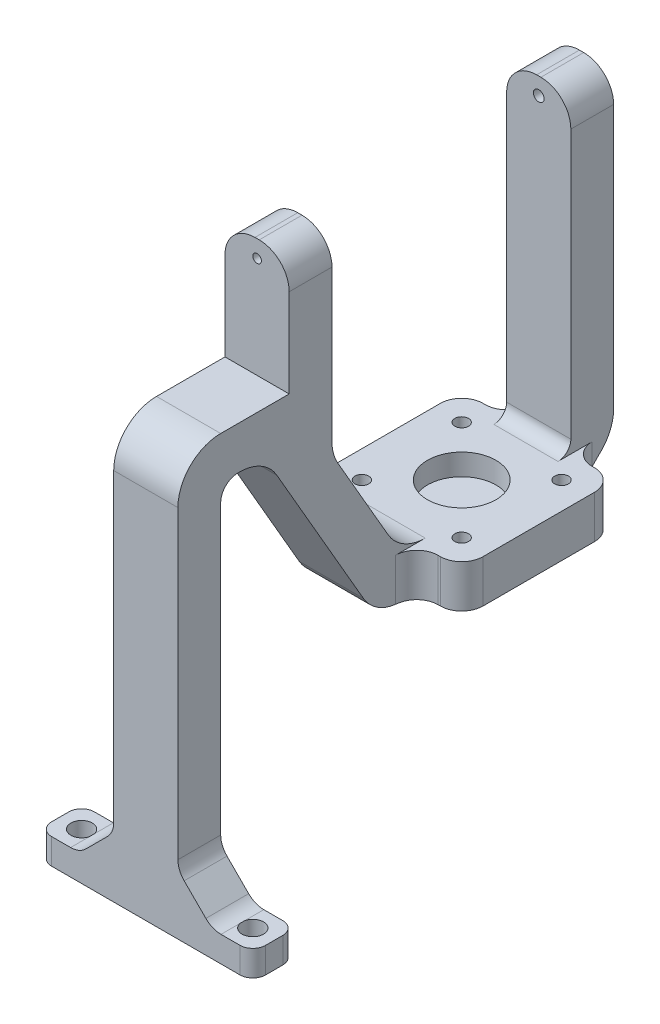
from build123d import *

# Parameters (mm, degrees)
SKETCH1_W           = 40
SKETCH1_H           = 50
BOSS_EXTRUDE1_DEPTH = 5
BOSS_EXTRUDE2_DEPTH = 7.5
FILLET3_R           = 10
SKETCH6_W           = 36
SKETCH6_H           = 10
BOSS_EXTRUDE3_DEPTH = 18
SKETCH7_R           = 8
CUT_EXTRUDE3_DEPTH  = 5
FILLET5_R           = 5
SKETCH8_R           = 1.6
CUT_EXTRUDE4_DEPTH  = 100.116132934
FILLET6_R           = 3
BOSS_EXTRUDE4_DEPTH = 15
SKETCH10_R          = 1
CUT_EXTRUDE5_DEPTH  = 500.756658462
FILLET8_R           = 10
FILLET9_R           = 7
CUT_EXTRUDE7_DEPTH  = 5
FILLET10_R          = 4
SKETCH13_W          = 10
SKETCH13_H          = 6
BOSS_EXTRUDE5_DEPTH = 25
CHAMFER1_SIZE       = 8
FILLET11_R          = 5
FILLET12_R          = 3
BOSS_EXTRUDE7_DEPTH = 10
CHAMFER2_SIZE       = 10
FILLET15_R          = 10
FILLET16_R          = 3
FILLET17_R          = 5
SKETCH19_R          = 1.25
CUT_EXTRUDE8_DEPTH  = 10
SKETCH20_R          = 2.5
CUT_EXTRUDE9_DEPTH  = 153.367653519


with BuildPart() as part:
    # Sketch1 → Boss-Extrude1 (new body)
    with BuildSketch(Plane.XY):
        with Locations((0, 421.657979857)):
            Rectangle(SKETCH1_W, SKETCH1_H)
    extrude(amount=BOSS_EXTRUDE1_DEPTH)

    # Sketch5 → Boss-Extrude2 (add, symmetric)
    with BuildSketch(Plane(origin=(0, 0, 0), x_dir=(0, 0, -1), z_dir=(1, 0, 0))):
        Polygon((-10, 370), (-10, 467.320715151), (16, 467.320715151), (42.019504932, 422.253610621), (76.24600224, 422.253610621), (76.24600224, 412.253610621), (36.24600224, 412.253610621), (10.226497308, 457.320715151), (0, 457.320715151), (0, 370), align=None)
    extrude(amount=BOSS_EXTRUDE2_DEPTH, both=True)

    # Fillet3
    fillet3_edges = [part.edges().sort_by_distance(p)[0] for p in [
        (0, 457.320715151, -10.226497308),
        (0, 412.253610621, -36.24600224),
        (0, 422.253610621, -42.019504932),
        (0, 467.320715151, 10),
    ]]
    fillet(fillet3_edges, radius=FILLET3_R)

    # Sketch6 → Boss-Extrude3 (add, symmetric)
    with BuildSketch(Plane(origin=(0, 0, 0), x_dir=(0, 0, -1), z_dir=(1, 0, 0))):
        with Locations((63.814228499, 417.253610621)):
            Rectangle(SKETCH6_W, SKETCH6_H)
    extrude(amount=BOSS_EXTRUDE3_DEPTH, both=True)

    # Sketch7 → Cut-Extrude3 (cut)
    with BuildSketch(Plane(origin=(0, 422.253610621, 0), x_dir=(1, 0, 0), z_dir=(0, 1, 0))):
        with Locations(Location((0, 63.814228499, 0), (0, 0, 270))):
            Circle(SKETCH7_R)
    extrude(amount=-CUT_EXTRUDE3_DEPTH, mode=Mode.SUBTRACT)

    # Fillet5
    fillet5_edges = [part.edges().sort_by_distance(p)[0] for p in [
        (-7.5, 417.253610621, -45.814228499),
    ]]
    fillet(fillet5_edges, radius=FILLET5_R)
    fillet5_2_edges = [part.edges().sort_by_distance(p)[0] for p in [
        (-18, 417.253610621, -45.814228499),
    ]]
    fillet(fillet5_2_edges, radius=FILLET5_R)
    fillet5_3_edges = [part.edges().sort_by_distance(p)[0] for p in [
        (7.5, 417.253610621, -45.814228499),
    ]]
    fillet(fillet5_3_edges, radius=FILLET5_R)
    fillet5_4_edges = [part.edges().sort_by_distance(p)[0] for p in [
        (18, 417.253610621, -45.814228499),
    ]]
    fillet(fillet5_4_edges, radius=FILLET5_R)
    fillet5_5_edges = [part.edges().sort_by_distance(p)[0] for p in [
        (18, 417.253610621, -81.814228499),
    ]]
    fillet(fillet5_5_edges, radius=FILLET5_R)
    fillet5_6_edges = [part.edges().sort_by_distance(p)[0] for p in [
        (-18, 417.253610621, -81.814228499),
    ]]
    fillet(fillet5_6_edges, radius=FILLET5_R)

    # Sketch8 → Cut-Extrude4 (cut, through all)
    with BuildSketch(Plane(origin=(0, 422.253610621, 0), x_dir=(1, 0, 0), z_dir=(0, 1, 0))):
        with Locations(Location((11.66726189, 52.14696661, 0), (0, 0, 270))):
            Circle(SKETCH8_R)
        with Locations(Location((-11.66726189, 52.14696661, 0), (0, 0, 270))):
            Circle(SKETCH8_R)
        with Locations(Location((-11.66726189, 75.481490389, 0), (0, 0, 270))):
            Circle(SKETCH8_R)
        with Locations(Location((11.66726189, 75.481490389, 0), (0, 0, 270))):
            Circle(SKETCH8_R)
    extrude(amount=-CUT_EXTRUDE4_DEPTH, mode=Mode.SUBTRACT)

    # Fillet6
    fillet6_edges = [part.edges().sort_by_distance(p)[0] for p in [
        (-20, 446.657979857, 2.5),
        (20, 446.657979857, 2.5),
        (20, 396.657979857, 2.5),
        (-20, 396.657979857, 2.5),
    ]]
    fillet(fillet6_edges, radius=FILLET6_R)

    # Sketch9 → Boss-Extrude4 (add)
    with BuildSketch(Plane(origin=(7.5, 0, 0), x_dir=(0, 0, -1), z_dir=(1, 0, 0))):
        Polygon((26, 450.000207075), (26, 495.000207075), (16, 495.000207075), (16, 467.320715151), align=None)
    extrude(amount=-BOSS_EXTRUDE4_DEPTH)

    # Sketch10 → Cut-Extrude5 (cut, through all)
    with BuildSketch(Plane.XY.offset(-16)):
        with Locations((0, 491.000207075)):
            Circle(SKETCH10_R)
    extrude(amount=-CUT_EXTRUDE5_DEPTH, mode=Mode.SUBTRACT)

    # Fillet8
    fillet8_edges = [part.edges().sort_by_distance(p)[0] for p in [
        (0, 450.000207075, -26),
    ]]
    fillet(fillet8_edges, radius=FILLET8_R)

    # Fillet9
    fillet9_edges = [part.edges().sort_by_distance(p)[0] for p in [
        (7.5, 495.000207075, -21),
        (-7.5, 495.000207075, -21),
    ]]
    fillet(fillet9_edges, radius=FILLET9_R)

    # Sketch12 → Cut-Extrude7 (cut)
    with BuildSketch(Plane.XY.offset(5)):
        with BuildLine():
            Line((7.5, 396.657979857), (17, 396.657979857))
            ThreePointArc((17, 396.657979857), (19.121320344, 397.536659513), (20, 399.657979857))
            Line((20, 399.657979857), (20, 443.657979857))
            ThreePointArc((20, 443.657979857), (19.121320344, 445.7793002), (17, 446.657979857))
            Line((17, 446.657979857), (7.5, 446.657979857))
            Line((7.5, 446.657979857), (7.5, 396.657979857))
        make_face()
        with BuildLine():
            Line((-20, 443.657979857), (-20, 399.657979857))
            ThreePointArc((-20, 399.657979857), (-19.121320344, 397.536659513), (-17, 396.657979857))
            Line((-17, 396.657979857), (-7.5, 396.657979857))
            Line((-7.5, 396.657979857), (-7.5, 446.657979857))
            Line((-7.5, 446.657979857), (-17, 446.657979857))
            ThreePointArc((-17, 446.657979857), (-19.121320344, 445.7793002), (-20, 443.657979857))
        make_face()
    extrude(amount=-CUT_EXTRUDE7_DEPTH, mode=Mode.SUBTRACT)

    # Fillet10
    fillet10_edges = [part.edges().sort_by_distance(p)[0] for p in [
        (0, 457.320715151, 0),
    ]]
    fillet(fillet10_edges, radius=FILLET10_R)

    # Sketch13 → Boss-Extrude5 (add, symmetric)
    with BuildSketch(Plane(origin=(0, 0, 0), x_dir=(0, 0, -1), z_dir=(1, 0, 0))):
        with Locations((-5, 373)):
            Rectangle(SKETCH13_W, SKETCH13_H)
    extrude(amount=BOSS_EXTRUDE5_DEPTH, both=True)

    # Chamfer1
    chamfer1_edges = [part.edges().sort_by_distance(p)[0] for p in [
        (7.5, 376, 5),
        (-7.5, 376, 5),
    ]]
    chamfer(chamfer1_edges, length=CHAMFER1_SIZE)

    # Fillet11
    fillet11_edges = [part.edges().sort_by_distance(p)[0] for p in [
        (-15.5, 376, 5),
        (-7.5, 384, 5),
        (7.5, 384, 5),
        (15.5, 376, 5),
    ]]
    fillet(fillet11_edges, radius=FILLET11_R)

    # Fillet12
    fillet12_edges = [part.edges().sort_by_distance(p)[0] for p in [
        (-25, 373, 10),
        (-25, 373, 0),
        (25, 373, 10),
        (25, 373, 0),
    ]]
    fillet(fillet12_edges, radius=FILLET12_R)

    # Sketch18 → Boss-Extrude7 (add)
    with BuildSketch(Plane(origin=(0, 0, -81.814228499), x_dir=(-1, 0, 0), z_dir=(0, 0, -1))):
        with BuildLine():
            Line((7.5, 412.253610621), (7.5, 488.000207075))
            ThreePointArc((7.5, 488.000207075), (5.449747468, 492.949954543), (0.5, 495.000207075))
            Line((0.5, 495.000207075), (-0.5, 495.000207075))
            ThreePointArc((-0.5, 495.000207075), (-5.449747468, 492.949954543), (-7.5, 488.000207075))
            Line((-7.5, 488.000207075), (-7.5, 412.253610621))
            Line((-7.5, 412.253610621), (7.5, 412.253610621))
        make_face()
    extrude(amount=BOSS_EXTRUDE7_DEPTH)

    # Chamfer2
    chamfer2_edges = [part.edges().sort_by_distance(p)[0] for p in [
        (0, 412.253610621, -91.814228499),
    ]]
    chamfer(chamfer2_edges, length=CHAMFER2_SIZE)

    # Fillet15
    fillet15_edges = [part.edges().sort_by_distance(p)[0] for p in [
        (0, 422.253610621, -91.814228499),
    ]]
    fillet(fillet15_edges, radius=FILLET15_R)

    # Fillet16
    fillet16_edges = [part.edges().sort_by_distance(p)[0] for p in [
        (0, 422.253610621, -81.814228499),
    ]]
    fillet(fillet16_edges, radius=FILLET16_R)

    # Fillet17
    fillet17_edges = [part.edges().sort_by_distance(p)[0] for p in [
        (7.5, 417.253610621, -81.814228499),
        (-7.5, 417.253610621, -81.814228499),
    ]]
    fillet(fillet17_edges, radius=FILLET17_R)

    # Sketch19 → Cut-Extrude8 (cut)
    with BuildSketch(Plane(origin=(0, 0, -91.814228499), x_dir=(-1, 0, 0), z_dir=(0, 0, -1))):
        with Locations(Location((0, 491.000207075, 0), (0, 0, 90))):
            Circle(SKETCH19_R)
    extrude(amount=-CUT_EXTRUDE8_DEPTH, mode=Mode.SUBTRACT)

    # Sketch20 → Cut-Extrude9 (cut, through all)
    with BuildSketch(Plane(origin=(0, 376, 0), x_dir=(1, 0, 0), z_dir=(0, 1, 0))):
        with Locations(Location((-20, -5, 0), (0, 0, 270))):
            Circle(SKETCH20_R)
        with Locations(Location((20, -5, 0), (0, 0, 270))):
            Circle(SKETCH20_R)
    extrude(amount=-CUT_EXTRUDE9_DEPTH, mode=Mode.SUBTRACT)


solid = part.part
